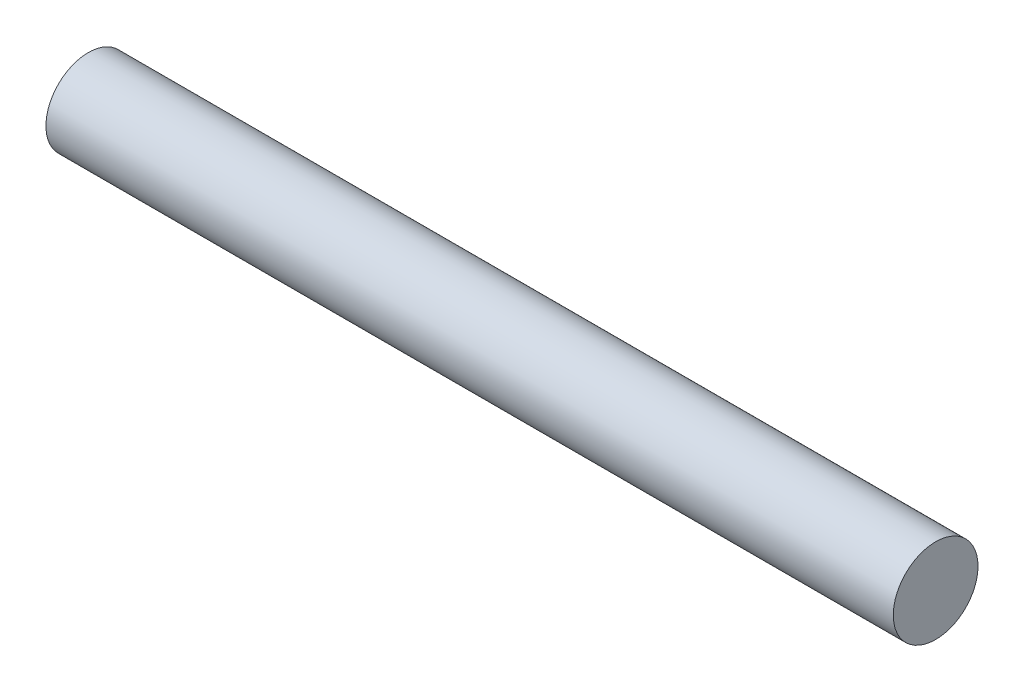
from build123d import *

# Parameters (mm, degrees)
SKETCH_1_R      = 5
EXTRUDE_1_DEPTH = 50


with BuildPart() as part:
    # Эскиз1 → Бобышка-Вытянуть1 (new, symmetric)
    with BuildSketch(Plane(origin=(0, 0, 0), x_dir=(0, 0, -1), z_dir=(1, 0, 0))):
        Circle(SKETCH_1_R)
    extrude(amount=EXTRUDE_1_DEPTH, both=True)


solid = part.part
